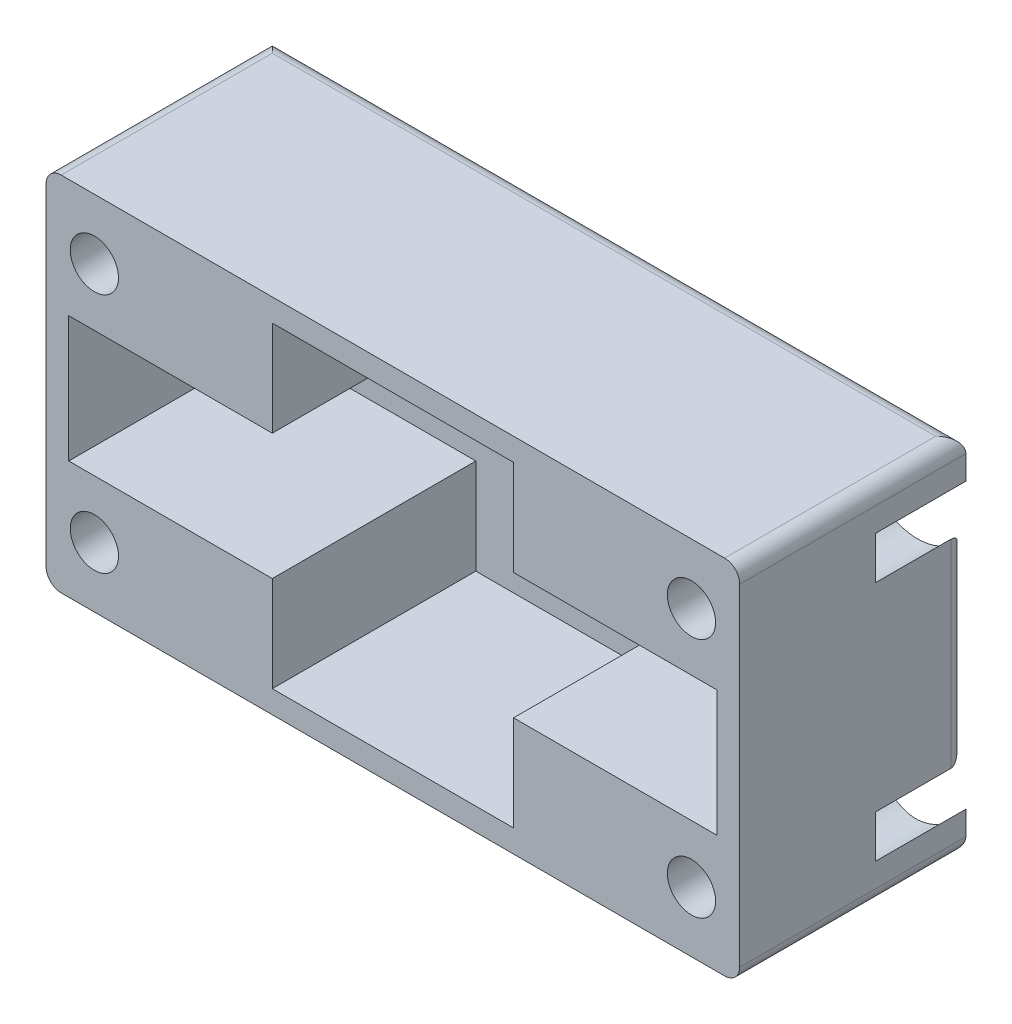
from build123d import *

# Parameters (mm, degrees)
SKETCH1_W           = 7.5
SKETCH1_H           = 3.913043478
BOSS_EXTRUDE1_DEPTH = 7.5
SHELL2_T            = -0.75
SKETCH1_4_W         = 7.5
SKETCH1_4_H         = 3.913043478
BOSS_EXTRUDE2_DEPTH = 7.5
HOLE2_D             = 1.6
HOLE2_DEPTH         = 10
HOLE2_CBORE_D       = 3.5
HOLE2_CBORE_DEPTH   = 3
FILLET1_R           = 0.5


with BuildPart() as part:
    # Sketch1 → Boss-Extrude1 (new body)
    with BuildSketch(Plane.XY):
        Polygon((4, 2.086956522), (4, 6), (-4, 6), (-4, 2.086956522), (-11.5, 2.086956522), (-11.5, -2.086956522), (-4, -2.086956522), (-4, -6), (4, -6), (4, -2.086956522), (11.5, -2.086956522), (11.5, 2.086956522), align=None)
        with Locations((-7.75, 4.043478261)):
            Rectangle(SKETCH1_W, SKETCH1_H)
        with Locations((7.75, 4.043478261)):
            Rectangle(SKETCH1_W, SKETCH1_H)
        with Locations((-7.75, -4.043478261)):
            Rectangle(SKETCH1_W, SKETCH1_H)
        with Locations((7.75, -4.043478261)):
            Rectangle(SKETCH1_W, SKETCH1_H)
    extrude(amount=BOSS_EXTRUDE1_DEPTH)

    # Shell2
    shell2_openings = [part.faces().sort_by_distance(p)[0] for p in [
        (0, 0, 7.5),
    ]]
    offset(amount=SHELL2_T, openings=shell2_openings, kind=Kind.INTERSECTION)

    # Sketch1<4> → Boss-Extrude2 (add)
    with BuildSketch(Plane.XY):
        with Locations((7.75, 4.043478261)):
            Rectangle(SKETCH1_4_W, SKETCH1_4_H)
        with Locations((-7.75, 4.043478261)):
            Rectangle(SKETCH1_4_W, SKETCH1_4_H)
        with Locations((-7.75, -4.043478261)):
            Rectangle(SKETCH1_4_W, SKETCH1_4_H)
        with Locations((7.75, -4.043478261)):
            Rectangle(SKETCH1_4_W, SKETCH1_4_H)
    extrude(amount=BOSS_EXTRUDE2_DEPTH)

    # Hole2
    with Locations(Plane(origin=(0, 0, 0), x_dir=(-1, 0, 0), z_dir=(0, 0, -1))):
        with Locations((-9.9, -4), (9.9, 4), (9.9, -4), (-9.9, 4)):
            CounterBoreHole(HOLE2_D / 2, HOLE2_CBORE_D / 2, HOLE2_CBORE_DEPTH, depth=HOLE2_DEPTH)

    # Fillet1
    # the kernel refuses this fillet: 0.5 mm, written as the material it takes off along each edge
    with BuildSketch(Plane(origin=(-11.5, 6, -1.25), x_dir=(1, 0, 0), z_dir=(0, 0, 1)), Plane(origin=(11.5, -6, -1.25), x_dir=(-1, 0, 0), z_dir=(0, 0, 1))) as fillet1_piece_1:
        with BuildLine():
            CenterArc((FILLET1_R, -FILLET1_R), FILLET1_R, 90, 90)
            Line((0, -FILLET1_R), (0, 0))
            Line((0, 0), (FILLET1_R, 0))
        make_face()
    extrude(amount=10, mode=Mode.SUBTRACT)
    with BuildSketch(Plane(origin=(-11.5, 4.541127656, 0), x_dir=(1, 0, 0), z_dir=(0, -1, 0)), Plane(origin=(11.5, 4.541127656, 0), x_dir=(0, 0, 1), z_dir=(0, -1, 0))) as fillet1_piece_2:
        with BuildLine():
            CenterArc((FILLET1_R, FILLET1_R), FILLET1_R, 180, 90)
            Line((0, FILLET1_R), (0, 0))
            Line((0, 0), (FILLET1_R, 0))
        make_face()
    extrude(amount=9.082255312, mode=Mode.SUBTRACT)
    with BuildSketch(Plane(origin=(12.75, 6, 0), x_dir=(0, 0, 1), z_dir=(-1, 0, 0))) as fillet1_piece_3:
        with BuildLine():
            CenterArc((FILLET1_R, -FILLET1_R), FILLET1_R, 90, 90)
            Line((0, -FILLET1_R), (0, 0))
            Line((0, 0), (FILLET1_R, 0))
        make_face()
    extrude(amount=25.5, mode=Mode.SUBTRACT)
    with BuildSketch(Plane(origin=(11.5, 6, -1.25), x_dir=(-1, 0, 0), z_dir=(0, 0, 1)), Plane(origin=(-11.5, -6, -1.25), x_dir=(1, 0, 0), z_dir=(0, 0, 1))) as fillet1_piece_4:
        with BuildLine():
            CenterArc((FILLET1_R, FILLET1_R), FILLET1_R, 180, 90)
            Line((0, FILLET1_R), (0, 0))
            Line((0, 0), (FILLET1_R, 0))
        make_face()
    extrude(amount=10, mode=Mode.SUBTRACT)
    with BuildSketch(Plane(origin=(12.75, -6, 0), x_dir=(0, 0, 1), z_dir=(-1, 0, 0))) as fillet1_piece_5:
        with BuildLine():
            CenterArc((FILLET1_R, FILLET1_R), FILLET1_R, 180, 90)
            Line((0, FILLET1_R), (0, 0))
            Line((0, 0), (FILLET1_R, 0))
        make_face()
    extrude(amount=25.5, mode=Mode.SUBTRACT)


solid = part.part
